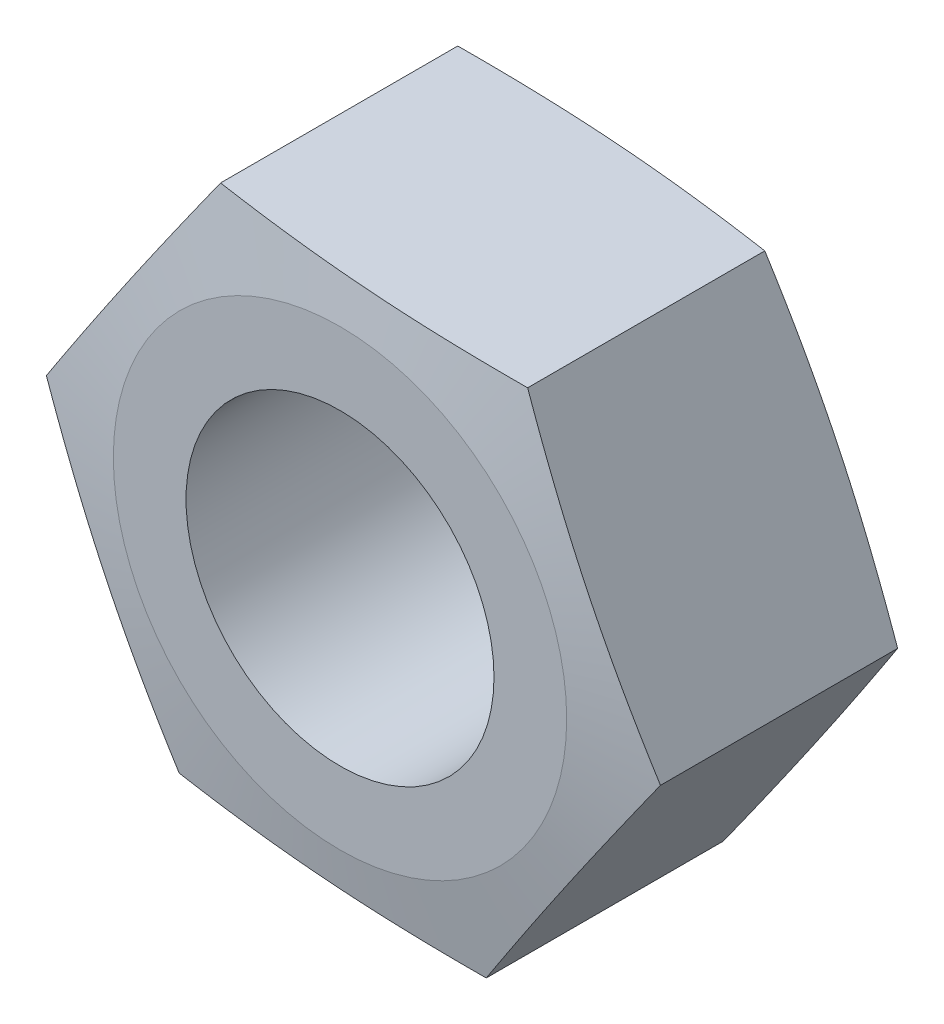
from build123d import *

# Parameters (mm, degrees)
EXTRUDE_1_DEPTH     = 6
SKETCH_5_R          = 3.5
CUT_EXTRUDE_2_DEPTH = 12.161967285
CHAMFER_1_SIZE      = 0.5


with BuildPart() as part:
    # Эскиз1 → Вытянуть1 (new body)
    with BuildSketch(Plane.XY):
        Polygon((-3.019213701, 6.315405658), (-6.978908586, 0.542987065), (-3.959694885, -5.772418593), (3.019213701, -6.315405658), (6.978908586, -0.542987065), (3.959694885, 5.772418593), align=None)
    extrude(amount=EXTRUDE_1_DEPTH)

    # Вырез-По траектории1: sweep along a path in Эскиз3
    with BuildLine(Plane(origin=(0, 0, 0), x_dir=(-1, 0, 0), z_dir=(0, 0, -1))) as sweep_1_path:
        CenterArc((0, 0), 4.80754516, 0, 360)
    # Эскиз4 → Вырез-По траектории1 (sweep, cut)
    with BuildSketch(Plane(origin=(0, 0, 0), x_dir=(1, 0, 0), z_dir=(0, 1, 0))):
        Polygon((-5.152045548, 0), (-8.017144415, -0.472678529), (-8.017144415, 0.689853389), align=None)
    sweep_1 = sweep(path=sweep_1_path.line, mode=Mode.SUBTRACT)

    # Зеркальное отражение1: Вырез-По траектории1 across plane
    add(sweep_1.mirror(Plane(origin=(0, 0, 3), x_dir=(1, 0, 0), z_dir=(0, 0, -1))), mode=Mode.SUBTRACT)

    # Эскиз5 → Вытянуть2 (cut, through all)
    with BuildSketch(Plane.XY.offset(6)):
        Circle(SKETCH_5_R)
    extrude(amount=-CUT_EXTRUDE_2_DEPTH, mode=Mode.SUBTRACT)

    # Фаска1
    chamfer_1_edges = [part.edges().sort_by_distance(p)[0] for p in [
        (-3.5, 0, 0),
    ]]
    chamfer(chamfer_1_edges, length=CHAMFER_1_SIZE)


solid = part.part
